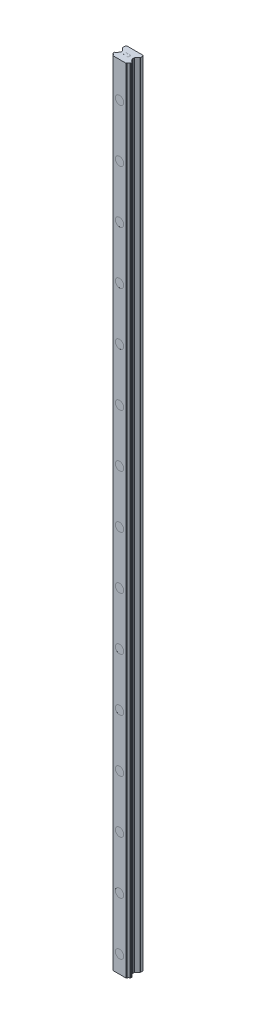
from build123d import *

# Parameters (mm, degrees)
BOSS_EXTRU_1_DEPTH                          = 900
ENL_V_MAT_EXTRU_1_DEPTH                     = 901.225666152
ENL_V_MAT_EXTRU_2_DEPTH                     = 901.225666152
ENL_V_MAT_EXTRU_3_DEPTH                     = 0.005833333
ENL_V_MAT_EXTRU_4_DEPTH                     = 0.005833333
ENL_V_MAT_EXTRU_5_DEPTH                     = 0.005833333
ENL_V_MAT_EXTRU_6_DEPTH                     = 0.005833333
ESQUISSE8_W                                 = 4.75
ESQUISSE8_H                                 = 0.00999998
ESQUISSE9_W                                 = 4.75
ESQUISSE9_H                                 = 0.00999998
ESQUISSE10_W                                = 4.75
ESQUISSE10_H                                = 0.00999998
ESQUISSE11_W                                = 4.75
ESQUISSE11_H                                = 0.00999998
ESQUISSE12_W                                = 4.75
ESQUISSE12_H                                = 0.00999998
ESQUISSE13_W                                = 4.75
ESQUISSE13_H                                = 0.00999998
ESQUISSE14_W                                = 4.75
ESQUISSE14_H                                = 0.00999998
ESQUISSE15_W                                = 4.75
ESQUISSE15_H                                = 0.00999998
ESQUISSE16_W                                = 4.75
ESQUISSE16_H                                = 0.00999998
ESQUISSE17_W                                = 4.75
ESQUISSE17_H                                = 0.00999998
ESQUISSE18_W                                = 4.75
ESQUISSE18_H                                = 0.00999998
ESQUISSE19_W                                = 4.75
ESQUISSE19_H                                = 0.00999998
ESQUISSE20_W                                = 4.75
ESQUISSE20_H                                = 0.00999998
ESQUISSE21_W                                = 4.75
ESQUISSE21_H                                = 0.00999998
ESQUISSE22_W                                = 4.75
ESQUISSE22_H                                = 0.00999998
CHAMBRAGE_POUR_VIS_T_TE_HEXAGONALE_2_COUNT  = 2
CHAMBRAGE_POUR_VIS_T_TE_HEXAGONALE_2_PITCH  = 60
CHAMBRAGE_POUR_VIS_T_TE_HEXAGONALE_3_COUNT  = 2
CHAMBRAGE_POUR_VIS_T_TE_HEXAGONALE_3_PITCH  = 120
CHAMBRAGE_POUR_VIS_T_TE_HEXAGONALE_4_COUNT  = 2
CHAMBRAGE_POUR_VIS_T_TE_HEXAGONALE_4_PITCH  = 180
CHAMBRAGE_POUR_VIS_T_TE_HEXAGONALE_5_COUNT  = 2
CHAMBRAGE_POUR_VIS_T_TE_HEXAGONALE_5_PITCH  = 240
CHAMBRAGE_POUR_VIS_T_TE_HEXAGONALE_6_COUNT  = 2
CHAMBRAGE_POUR_VIS_T_TE_HEXAGONALE_6_PITCH  = 300
CHAMBRAGE_POUR_VIS_T_TE_HEXAGONALE_7_COUNT  = 2
CHAMBRAGE_POUR_VIS_T_TE_HEXAGONALE_7_PITCH  = 360
CHAMBRAGE_POUR_VIS_T_TE_HEXAGONALE_8_COUNT  = 2
CHAMBRAGE_POUR_VIS_T_TE_HEXAGONALE_8_PITCH  = 420
CHAMBRAGE_POUR_VIS_T_TE_HEXAGONALE_9_COUNT  = 2
CHAMBRAGE_POUR_VIS_T_TE_HEXAGONALE_9_PITCH  = 480
CHAMBRAGE_POUR_VIS_T_TE_HEXAGONALE_10_COUNT = 2
CHAMBRAGE_POUR_VIS_T_TE_HEXAGONALE_10_PITCH = 540
CHAMBRAGE_POUR_VIS_T_TE_HEXAGONALE_11_COUNT = 2
CHAMBRAGE_POUR_VIS_T_TE_HEXAGONALE_11_PITCH = 600
CHAMBRAGE_POUR_VIS_T_TE_HEXAGONALE_12_COUNT = 2
CHAMBRAGE_POUR_VIS_T_TE_HEXAGONALE_12_PITCH = 660
CHAMBRAGE_POUR_VIS_T_TE_HEXAGONALE_13_COUNT = 2
CHAMBRAGE_POUR_VIS_T_TE_HEXAGONALE_13_PITCH = 720
CHAMBRAGE_POUR_VIS_T_TE_HEXAGONALE_14_COUNT = 2
CHAMBRAGE_POUR_VIS_T_TE_HEXAGONALE_14_PITCH = 780
CHAMBRAGE_POUR_VIS_T_TE_HEXAGONALE_15_COUNT = 2
CHAMBRAGE_POUR_VIS_T_TE_HEXAGONALE_15_PITCH = 840
CHAMBRAGE_POUR_VIS_T_TE_HEXAGONALE_16_COUNT = 2
CHAMBRAGE_POUR_VIS_T_TE_HEXAGONALE_16_PITCH = 900
CHAMBRAGE_POUR_VIS_T_TE_HEXAGONALE_17_COUNT = 2
CHAMBRAGE_POUR_VIS_T_TE_HEXAGONALE_17_PITCH = 960
CHANFREIN2_START                            = -10.044358677
CHANFREIN2_DEPTH                            = 1.074266079
CHANFREIN4_SIZE                             = 1
CHANFREIN5_SIZE                             = 0.168439437
CHANFREIN5_SIZE2                            = 0.167476662
CONG_1_R                                    = 0.499999935
CONG_2_R                                    = 1.000000028


with BuildPart() as part:
    # Esquisse1 → Boss.-Extru.1 (new body)
    with BuildSketch(Plane.XZ):
        with BuildLine():
            Line((9.99999999, 0), (9.99999999, 14.7307206))
            Line((9.99999999, 14.7307206), (9.564438518, 15.166282072))
            ThreePointArc((9.564438518, 15.166282072), (8.447852487, 15.6868294), (7.848162245, 16.762982503))
            ThreePointArc((7.848162245, 16.762982503), (7.775191488, 16.95300083), (7.632531165, 17.098189425))
            Line((7.632531165, 17.098189425), (7.230720605, 17.499999985))
            Line((7.230720605, 17.499999985), (-7.230720615, 17.499999985))
            Line((-7.230720615, 17.499999985), (-7.632531175, 17.098189425))
            ThreePointArc((-7.632531175, 17.098189425), (-7.775191503, 16.953000832), (-7.84816225, 16.762982498))
            ThreePointArc((-7.84816225, 16.762982498), (-8.447852495, 15.686829397), (-9.564438528, 15.166282072))
            Line((-9.564438528, 15.166282072), (-10, 14.7307206))
            Line((-10, 14.7307206), (-10, 0))
            Line((-10, 0), (9.99999999, 0))
        make_face()
    extrude(amount=-BOSS_EXTRU_1_DEPTH)

    # Esquisse2 → Enlèv. mat.-Extru.1 (cut, through all)
    with BuildSketch(Plane(origin=(0, 900, 0), x_dir=(-1, 0, 0), z_dir=(0, 1, 0))):
        with BuildLine():
            Line((-10, 13.25927938), (-10, 4.07072061))
            Line((-10, 4.07072061), (-6.6, 7.47072061))
            Line((-6.6, 7.47072061), (-6.6, 9.85927938))
            Line((-6.6, 9.85927938), (-7.63016236, 10.88944174))
            ThreePointArc((-7.63016236, 10.88944174), (-7.773916172, 11.035785914), (-7.84680643, 11.2275378))
            ThreePointArc((-7.84680643, 11.2275378), (-8.448775616, 12.313442506), (-9.575577649, 12.834857029))
            Line((-9.575577649, 12.834857029), (-10, 13.25927938))
        make_face()
    extrude(amount=-ENL_V_MAT_EXTRU_1_DEPTH, mode=Mode.SUBTRACT)

    # Esquisse3 → Enlèv. mat.-Extru.2 (cut, through all)
    with BuildSketch(Plane(origin=(0, 900, 0), x_dir=(-1, 0, 0), z_dir=(0, 1, 0))):
        with BuildLine():
            Line((10, 4.07072061), (10, 13.25927938))
            Line((10, 13.25927938), (9.575577649, 12.834857029))
            ThreePointArc((9.575577649, 12.834857029), (8.448775615, 12.313442505), (7.84680643, 11.2275378))
            ThreePointArc((7.84680643, 11.2275378), (7.773916168, 11.035785916), (7.63016236, 10.88944174))
            Line((7.63016236, 10.88944174), (6.6, 9.85927938))
            Line((6.6, 9.85927938), (6.6, 7.47072061))
            Line((6.6, 7.47072061), (10, 4.07072061))
        make_face()
    extrude(amount=-ENL_V_MAT_EXTRU_2_DEPTH, mode=Mode.SUBTRACT)

    # Esquisse4 → Enlèv. mat.-Extru.3 (cut)
    with BuildSketch(Plane(origin=(0, 900, 0), x_dir=(-1, 0, 0), z_dir=(0, 1, 0))):
        Polygon((2.399840333, 9.163802667), (1.924196167, 8.529865167), (0.588819, 7.02975), (2.946944, 7.02975), (2.946944, 7.258416667), (1.073395167, 7.258416667), (2.138571167, 8.479333333), (2.6231485, 9.1245), (2.872990046, 9.620713462), (2.568830976, 10.237019964), (2.120706, 10.45975), (1.46195, 10.45975), (1.010785672, 10.240441668), (0.794260833, 9.7956985), (0.794260833, 9.59), (1.026501, 9.59), (1.026501, 9.777833333), (1.178349667, 10.078979167), (1.479815167, 10.231083333), (2.100609, 10.231083333), (2.404306333, 10.079490167), (2.628338532, 9.627797385), align=None)
    extrude(amount=-ENL_V_MAT_EXTRU_3_DEPTH, mode=Mode.SUBTRACT)

    # Esquisse5 → Enlèv. mat.-Extru.4 (cut)
    with BuildSketch(Plane.XZ):
        Polygon((-0.577855833, 10.45975), (-2.568416667, 10.45975), (-2.568416667, 7.02975), (-0.577855833, 7.02975), (-0.577855833, 7.258416667), (-2.33975, 7.258416667), (-2.33975, 8.630416667), (-1.3795285, 8.630416667), (-1.3795285, 8.859083333), (-2.33975, 8.859083333), (-2.33975, 10.231083333), (-0.577855833, 10.231083333), align=None)
    extrude(amount=-ENL_V_MAT_EXTRU_4_DEPTH, mode=Mode.SUBTRACT)

    # Esquisse6 → Enlèv. mat.-Extru.5 (cut)
    with BuildSketch(Plane(origin=(0, 900, 0), x_dir=(-1, 0, 0), z_dir=(0, 1, 0))):
        Polygon((-0.577855833, 10.45975), (-2.568416667, 10.45975), (-2.568416667, 7.02975), (-0.577855833, 7.02975), (-0.577855833, 7.258416667), (-2.33975, 7.258416667), (-2.33975, 8.630416667), (-1.3795285, 8.630416667), (-1.3795285, 8.859083333), (-2.33975, 8.859083333), (-2.33975, 10.231083333), (-0.577855833, 10.231083333), align=None)
    extrude(amount=-ENL_V_MAT_EXTRU_5_DEPTH, mode=Mode.SUBTRACT)

    # Esquisse7 → Enlèv. mat.-Extru.6 (cut)
    with BuildSketch(Plane.XZ):
        Polygon((1.373230833, 9.748390167), (1.6345, 10.011765167), (1.6345, 7.025316667), (1.863166667, 7.025316667), (1.863166667, 10.455316667), (1.814932, 10.455316667), (1.3285685, 9.971441667), (0.993608, 9.801983333), (0.993608, 9.561066667), align=None)
    extrude(amount=-ENL_V_MAT_EXTRU_6_DEPTH, mode=Mode.SUBTRACT)

    # Esquisse8 → Enlèvement de matière-Révolution1 (revolve, cut)
    with BuildSketch(Plane(origin=(0, 20, 0), x_dir=(1, 0, 0), z_dir=(0, 1, 0))):
        with Locations((2.375, -17.49499999)):
            Rectangle(ESQUISSE8_W, ESQUISSE8_H)
    revolve(axis=Axis((0, 20, 17.49), (0, 0, 1)), mode=Mode.SUBTRACT)

    # Esquisse9 → Enlèvement de matière-Révolution2 (revolve, cut)
    with BuildSketch(Plane(origin=(0, 80, 0), x_dir=(1, 0, 0), z_dir=(0, 1, 0))):
        with Locations((2.375, -17.49499999)):
            Rectangle(ESQUISSE9_W, ESQUISSE9_H)
    revolve(axis=Axis((0, 80, 17.49), (0, 0, 1)), mode=Mode.SUBTRACT)

    # Esquisse10 → Enlèvement de matière-Révolution3 (revolve, cut)
    with BuildSketch(Plane(origin=(0, 140, 0), x_dir=(1, 0, 0), z_dir=(0, 1, 0))):
        with Locations((2.375, -17.49499999)):
            Rectangle(ESQUISSE10_W, ESQUISSE10_H)
    revolve(axis=Axis((0, 140, 17.49), (0, 0, 1)), mode=Mode.SUBTRACT)

    # Esquisse11 → Enlèvement de matière-Révolution4 (revolve, cut)
    with BuildSketch(Plane(origin=(0, 200, 0), x_dir=(1, 0, 0), z_dir=(0, 1, 0))):
        with Locations((2.375, -17.49499999)):
            Rectangle(ESQUISSE11_W, ESQUISSE11_H)
    revolve(axis=Axis((0, 200, 17.49), (0, 0, 1)), mode=Mode.SUBTRACT)

    # Esquisse12 → Enlèvement de matière-Révolution5 (revolve, cut)
    with BuildSketch(Plane(origin=(0, 260, 0), x_dir=(1, 0, 0), z_dir=(0, 1, 0))):
        with Locations((2.375, -17.49499999)):
            Rectangle(ESQUISSE12_W, ESQUISSE12_H)
    revolve(axis=Axis((0, 260, 17.49), (0, 0, 1)), mode=Mode.SUBTRACT)

    # Esquisse13 → Enlèvement de matière-Révolution6 (revolve, cut)
    with BuildSketch(Plane(origin=(0, 320, 0), x_dir=(1, 0, 0), z_dir=(0, 1, 0))):
        with Locations((2.375, -17.49499999)):
            Rectangle(ESQUISSE13_W, ESQUISSE13_H)
    revolve(axis=Axis((0, 320, 17.49), (0, 0, 1)), mode=Mode.SUBTRACT)

    # Esquisse14 → Enlèvement de matière-Révolution7 (revolve, cut)
    with BuildSketch(Plane(origin=(0, 380, 0), x_dir=(1, 0, 0), z_dir=(0, 1, 0))):
        with Locations((2.375, -17.49499999)):
            Rectangle(ESQUISSE14_W, ESQUISSE14_H)
    revolve(axis=Axis((0, 380, 17.49), (0, 0, 1)), mode=Mode.SUBTRACT)

    # Esquisse15 → Enlèvement de matière-Révolution8 (revolve, cut)
    with BuildSketch(Plane(origin=(0, 440, 0), x_dir=(1, 0, 0), z_dir=(0, 1, 0))):
        with Locations((2.375, -17.49499999)):
            Rectangle(ESQUISSE15_W, ESQUISSE15_H)
    revolve(axis=Axis((0, 440, 17.49), (0, 0, 1)), mode=Mode.SUBTRACT)

    # Esquisse16 → Enlèvement de matière-Révolution9 (revolve, cut)
    with BuildSketch(Plane(origin=(0, 500, 0), x_dir=(1, 0, 0), z_dir=(0, 1, 0))):
        with Locations((2.375, -17.49499999)):
            Rectangle(ESQUISSE16_W, ESQUISSE16_H)
    revolve(axis=Axis((0, 500, 17.49), (0, 0, 1)), mode=Mode.SUBTRACT)

    # Esquisse17 → Enlèvement de matière-Révolution10 (revolve, cut)
    with BuildSketch(Plane(origin=(0, 560, 0), x_dir=(1, 0, 0), z_dir=(0, 1, 0))):
        with Locations((2.375, -17.49499999)):
            Rectangle(ESQUISSE17_W, ESQUISSE17_H)
    revolve(axis=Axis((0, 560, 17.49), (0, 0, 1)), mode=Mode.SUBTRACT)

    # Esquisse18 → Enlèvement de matière-Révolution11 (revolve, cut)
    with BuildSketch(Plane(origin=(0, 620, 0), x_dir=(1, 0, 0), z_dir=(0, 1, 0))):
        with Locations((2.375, -17.49499999)):
            Rectangle(ESQUISSE18_W, ESQUISSE18_H)
    revolve(axis=Axis((0, 620, 17.49), (0, 0, 1)), mode=Mode.SUBTRACT)

    # Esquisse19 → Enlèvement de matière-Révolution12 (revolve, cut)
    with BuildSketch(Plane(origin=(0, 680, 0), x_dir=(1, 0, 0), z_dir=(0, 1, 0))):
        with Locations((2.375, -17.49499999)):
            Rectangle(ESQUISSE19_W, ESQUISSE19_H)
    revolve(axis=Axis((0, 680, 17.49), (0, 0, 1)), mode=Mode.SUBTRACT)

    # Esquisse20 → Enlèvement de matière-Révolution13 (revolve, cut)
    with BuildSketch(Plane(origin=(0, 740, 0), x_dir=(1, 0, 0), z_dir=(0, 1, 0))):
        with Locations((2.375, -17.49499999)):
            Rectangle(ESQUISSE20_W, ESQUISSE20_H)
    revolve(axis=Axis((0, 740, 17.49), (0, 0, 1)), mode=Mode.SUBTRACT)

    # Esquisse21 → Enlèvement de matière-Révolution14 (revolve, cut)
    with BuildSketch(Plane(origin=(0, 800, 0), x_dir=(1, 0, 0), z_dir=(0, 1, 0))):
        with Locations((2.375, -17.49499999)):
            Rectangle(ESQUISSE21_W, ESQUISSE21_H)
    revolve(axis=Axis((0, 800, 17.49), (0, 0, 1)), mode=Mode.SUBTRACT)

    # Esquisse22 → Enlèvement de matière-Révolution15 (revolve, cut)
    with BuildSketch(Plane(origin=(0, 860, 0), x_dir=(1, 0, 0), z_dir=(0, 1, 0))):
        with Locations((2.375, -17.49499999)):
            Rectangle(ESQUISSE22_W, ESQUISSE22_H)
    revolve(axis=Axis((0, 860, 17.49), (0, 0, 1)), mode=Mode.SUBTRACT)

    # Esquisse25 → Chambrage pour vis à tête hexagonale M81 (revolve, cut)
    with BuildSketch(Plane(origin=(0, 980, 0), x_dir=(0, 1, 0), z_dir=(1, 0, 0))):
        Polygon((0, 0), (0, 16.59), (4.75, 16.59), (4.75, 9), (3, 9), (3, 0), align=None)
    chambrage_pour_vis_t_te_hexagonale_m81 = revolve(axis=Axis((0, 980, -6.35), (0, 0, 1)), mode=Mode.SUBTRACT)

    # Chambrage pour vis _ t_te hexagonale 2: Chambrage pour vis à tête hexagonale M81 ×2
    with Locations(*[(0, -i * CHAMBRAGE_POUR_VIS_T_TE_HEXAGONALE_2_PITCH, 0) for i in range(1, CHAMBRAGE_POUR_VIS_T_TE_HEXAGONALE_2_COUNT)]):
        add(chambrage_pour_vis_t_te_hexagonale_m81, mode=Mode.SUBTRACT)

    # Chambrage pour vis _ t_te hexagonale 3: Chambrage pour vis à tête hexagonale M81 ×2
    with Locations(*[(0, -i * CHAMBRAGE_POUR_VIS_T_TE_HEXAGONALE_3_PITCH, 0) for i in range(1, CHAMBRAGE_POUR_VIS_T_TE_HEXAGONALE_3_COUNT)]):
        add(chambrage_pour_vis_t_te_hexagonale_m81, mode=Mode.SUBTRACT)

    # Chambrage pour vis _ t_te hexagonale 4: Chambrage pour vis à tête hexagonale M81 ×2
    with Locations(*[(0, -i * CHAMBRAGE_POUR_VIS_T_TE_HEXAGONALE_4_PITCH, 0) for i in range(1, CHAMBRAGE_POUR_VIS_T_TE_HEXAGONALE_4_COUNT)]):
        add(chambrage_pour_vis_t_te_hexagonale_m81, mode=Mode.SUBTRACT)

    # Chambrage pour vis _ t_te hexagonale 5: Chambrage pour vis à tête hexagonale M81 ×2
    with Locations(*[(0, -i * CHAMBRAGE_POUR_VIS_T_TE_HEXAGONALE_5_PITCH, 0) for i in range(1, CHAMBRAGE_POUR_VIS_T_TE_HEXAGONALE_5_COUNT)]):
        add(chambrage_pour_vis_t_te_hexagonale_m81, mode=Mode.SUBTRACT)

    # Chambrage pour vis _ t_te hexagonale 6: Chambrage pour vis à tête hexagonale M81 ×2
    with Locations(*[(0, -i * CHAMBRAGE_POUR_VIS_T_TE_HEXAGONALE_6_PITCH, 0) for i in range(1, CHAMBRAGE_POUR_VIS_T_TE_HEXAGONALE_6_COUNT)]):
        add(chambrage_pour_vis_t_te_hexagonale_m81, mode=Mode.SUBTRACT)

    # Chambrage pour vis _ t_te hexagonale 7: Chambrage pour vis à tête hexagonale M81 ×2
    with Locations(*[(0, -i * CHAMBRAGE_POUR_VIS_T_TE_HEXAGONALE_7_PITCH, 0) for i in range(1, CHAMBRAGE_POUR_VIS_T_TE_HEXAGONALE_7_COUNT)]):
        add(chambrage_pour_vis_t_te_hexagonale_m81, mode=Mode.SUBTRACT)

    # Chambrage pour vis _ t_te hexagonale 8: Chambrage pour vis à tête hexagonale M81 ×2
    with Locations(*[(0, -i * CHAMBRAGE_POUR_VIS_T_TE_HEXAGONALE_8_PITCH, 0) for i in range(1, CHAMBRAGE_POUR_VIS_T_TE_HEXAGONALE_8_COUNT)]):
        add(chambrage_pour_vis_t_te_hexagonale_m81, mode=Mode.SUBTRACT)

    # Chambrage pour vis _ t_te hexagonale 9: Chambrage pour vis à tête hexagonale M81 ×2
    with Locations(*[(0, -i * CHAMBRAGE_POUR_VIS_T_TE_HEXAGONALE_9_PITCH, 0) for i in range(1, CHAMBRAGE_POUR_VIS_T_TE_HEXAGONALE_9_COUNT)]):
        add(chambrage_pour_vis_t_te_hexagonale_m81, mode=Mode.SUBTRACT)

    # Chambrage pour vis _ t_te hexagonale 10: Chambrage pour vis à tête hexagonale M81 ×2
    with Locations(*[(0, -i * CHAMBRAGE_POUR_VIS_T_TE_HEXAGONALE_10_PITCH, 0) for i in range(1, CHAMBRAGE_POUR_VIS_T_TE_HEXAGONALE_10_COUNT)]):
        add(chambrage_pour_vis_t_te_hexagonale_m81, mode=Mode.SUBTRACT)

    # Chambrage pour vis _ t_te hexagonale 11: Chambrage pour vis à tête hexagonale M81 ×2
    with Locations(*[(0, -i * CHAMBRAGE_POUR_VIS_T_TE_HEXAGONALE_11_PITCH, 0) for i in range(1, CHAMBRAGE_POUR_VIS_T_TE_HEXAGONALE_11_COUNT)]):
        add(chambrage_pour_vis_t_te_hexagonale_m81, mode=Mode.SUBTRACT)

    # Chambrage pour vis _ t_te hexagonale 12: Chambrage pour vis à tête hexagonale M81 ×2
    with Locations(*[(0, -i * CHAMBRAGE_POUR_VIS_T_TE_HEXAGONALE_12_PITCH, 0) for i in range(1, CHAMBRAGE_POUR_VIS_T_TE_HEXAGONALE_12_COUNT)]):
        add(chambrage_pour_vis_t_te_hexagonale_m81, mode=Mode.SUBTRACT)

    # Chambrage pour vis _ t_te hexagonale 13: Chambrage pour vis à tête hexagonale M81 ×2
    with Locations(*[(0, -i * CHAMBRAGE_POUR_VIS_T_TE_HEXAGONALE_13_PITCH, 0) for i in range(1, CHAMBRAGE_POUR_VIS_T_TE_HEXAGONALE_13_COUNT)]):
        add(chambrage_pour_vis_t_te_hexagonale_m81, mode=Mode.SUBTRACT)

    # Chambrage pour vis _ t_te hexagonale 14: Chambrage pour vis à tête hexagonale M81 ×2
    with Locations(*[(0, -i * CHAMBRAGE_POUR_VIS_T_TE_HEXAGONALE_14_PITCH, 0) for i in range(1, CHAMBRAGE_POUR_VIS_T_TE_HEXAGONALE_14_COUNT)]):
        add(chambrage_pour_vis_t_te_hexagonale_m81, mode=Mode.SUBTRACT)

    # Chambrage pour vis _ t_te hexagonale 15: Chambrage pour vis à tête hexagonale M81 ×2
    with Locations(*[(0, -i * CHAMBRAGE_POUR_VIS_T_TE_HEXAGONALE_15_PITCH, 0) for i in range(1, CHAMBRAGE_POUR_VIS_T_TE_HEXAGONALE_15_COUNT)]):
        add(chambrage_pour_vis_t_te_hexagonale_m81, mode=Mode.SUBTRACT)

    # Chambrage pour vis _ t_te hexagonale 16: Chambrage pour vis à tête hexagonale M81 ×2
    with Locations(*[(0, -i * CHAMBRAGE_POUR_VIS_T_TE_HEXAGONALE_16_PITCH, 0) for i in range(1, CHAMBRAGE_POUR_VIS_T_TE_HEXAGONALE_16_COUNT)]):
        add(chambrage_pour_vis_t_te_hexagonale_m81, mode=Mode.SUBTRACT)

    # Chambrage pour vis _ t_te hexagonale 17: Chambrage pour vis à tête hexagonale M81 ×2
    with Locations(*[(0, -i * CHAMBRAGE_POUR_VIS_T_TE_HEXAGONALE_17_PITCH, 0) for i in range(1, CHAMBRAGE_POUR_VIS_T_TE_HEXAGONALE_17_COUNT)]):
        add(chambrage_pour_vis_t_te_hexagonale_m81, mode=Mode.SUBTRACT)

    # Chanfrein1
    # the kernel refuses this chamfer: 0.191149703, 0.094336042 mm, written as the material it adds along each edge
    with BuildSketch(Plane(origin=(-3.09209519, 899.994166667, 9.176748647), x_dir=(0, 1, 0), z_dir=(0.4425582548013743, 0, 0.8967397566223781))) as chanfrein1_piece_1_section:
        with BuildLine():
            Line((0.198006165, 0.003383795), (-0.006856462, -0.097719837))
            Line((-0.006856462, -0.097719837), (-0.010679456, -0.097719837))
            ThreePointArc((-0.010679456, -0.097719837), (-0.003822994, -0.048859918), (-0.003822994, 0))
            Line((-0.003822994, 0), (0, 0.003822994))
            ThreePointArc((0, 0.003822994), (0.099003082, 0.003822994), (0.198006165, 0.007206789))
            Line((0.198006165, 0.007206789), (0.198006165, 0.003383795))
        make_face()
    chanfrein1_piece_1 = extrude(amount=1.677450029, mode=Mode.PRIVATE)
    chanfrein1_piece_1 = split(chanfrein1_piece_1, bisect_by=Plane(origin=(-3.09209519, 900, 9.176748647), z_dir=(0, -1, 0)), keep=Keep.TOP, mode=Mode.PRIVATE)
    add(chanfrein1_piece_1)

    # Chanfrein2: read off the stored shape, not the designer's step
    # Chanfrein2 outline → Chanfrein2 (add)
    with BuildSketch(Plane(origin=(0, 0, 0), x_dir=(0.899105182547705, 0, 0.4377326475325529), z_dir=(0.4377326475325529, 0, -0.8991051825477049)).offset(CHANFREIN2_START)):
        Polygon((3.573773007, -899.994166667), (3.530228909, -899.994166667), (3.532306787, -900), (3.573773007, -900), align=None)
    extrude(amount=CHANFREIN2_DEPTH)

    # Chanfrein3
    # the kernel refuses this chamfer: 0.128863914, 0.056323057 mm, written as the material it takes off along each edge
    with BuildSketch(Plane(origin=(-2.285691092, 900, 10.604080366), x_dir=(-0.8967397566224526, 0, 0.4425582548012234), z_dir=(-0.44255825480122335, 0, -0.8967397566224526))) as chanfrein3_piece_1_section:
        with BuildLine():
            Line((0.133761133, 0.001608324), (-0.029823452, -0.052115449))
            Line((-0.029823452, -0.052115449), (-0.0321346, -0.050974853))
            ThreePointArc((-0.0321346, -0.050974853), (-0.015572983, -0.025731381), (-0.002311148, 0.001140596))
            Line((-0.002311148, 0.001140596), (0, 0.002577278))
            ThreePointArc((0, 0.002577278), (0.066880566, 0.002577278), (0.133761133, 0.004185602))
            Line((0.133761133, 0.004185602), (0.133761133, 0.001608324))
        make_face()
    chanfrein3_piece_1 = extrude(amount=1.545102405, mode=Mode.PRIVATE)
    chanfrein3_piece_1 = split(chanfrein3_piece_1, bisect_by=Plane(origin=(-2.195482591, 900, 10.422584045), z_dir=(0.4450822124591609, 0, -0.895489711918824)), keep=Keep.TOP, mode=Mode.PRIVATE)
    chanfrein3_piece_1 = split(chanfrein3_piece_1, bisect_by=Plane(origin=(-3.149203792, 900, 10.169305085), z_dir=(0.8931746492128387, 0, 0.44970995764328203)), keep=Keep.TOP, mode=Mode.PRIVATE)
    chanfrein3_piece_1 = split(chanfrein3_piece_1, bisect_by=Plane(origin=(-2.285691092, 899.994166667, 10.604080366), z_dir=(0, 1, 0)), keep=Keep.TOP, mode=Mode.PRIVATE)
    add(chanfrein3_piece_1, mode=Mode.SUBTRACT)

    # Chanfrein4
    chanfrein4_edges = [part.edges().sort_by_distance(p)[0] for p in [
        (-10, 450, 0),
        (9.99999999, 450, 0),
    ]]
    chamfer(chanfrein4_edges, length=CHANFREIN4_SIZE)

    # Chanfrein5
    chanfrein5_edges = [part.edges().sort_by_distance(p)[0] for p in [
        (-2.628338532, 899.997083333, 9.627797385),
    ]]
    chanfrein5_side = [part.faces().sort_by_distance(p)[0] for p in [
        (-2.516322433, 899.997083333, 9.853643776),
    ]]
    chamfer(chanfrein5_edges, length=CHANFREIN5_SIZE, length2=CHANFREIN5_SIZE2, reference=chanfrein5_side[0])

    # Congé1
    cong_1_edges = [part.edges().sort_by_distance(p)[0] for p in [
        (-10, 450, 14.7307206),
        (-9.564438528, 450, 15.166282072),
        (9.564438518, 450, 15.166282072),
        (9.99999999, 450, 14.7307206),
        (10, 450, 13.25927938),
        (9.575577649, 450, 12.834857029),
        (-9.575577649, 450, 12.834857029),
        (-10, 450, 13.25927938),
    ]]
    fillet(cong_1_edges, radius=CONG_1_R)

    # Congé2
    cong_2_edges = [part.edges().sort_by_distance(p)[0] for p in [
        (6.6, 450, 9.85927938),
        (6.6, 450, 7.47072061),
        (10, 450, 4.07072061),
        (-10, 450, 4.07072061),
        (-6.6, 450, 7.47072061),
        (-6.6, 450, 9.85927938),
    ]]
    fillet(cong_2_edges, radius=CONG_2_R)


solid = part.part
